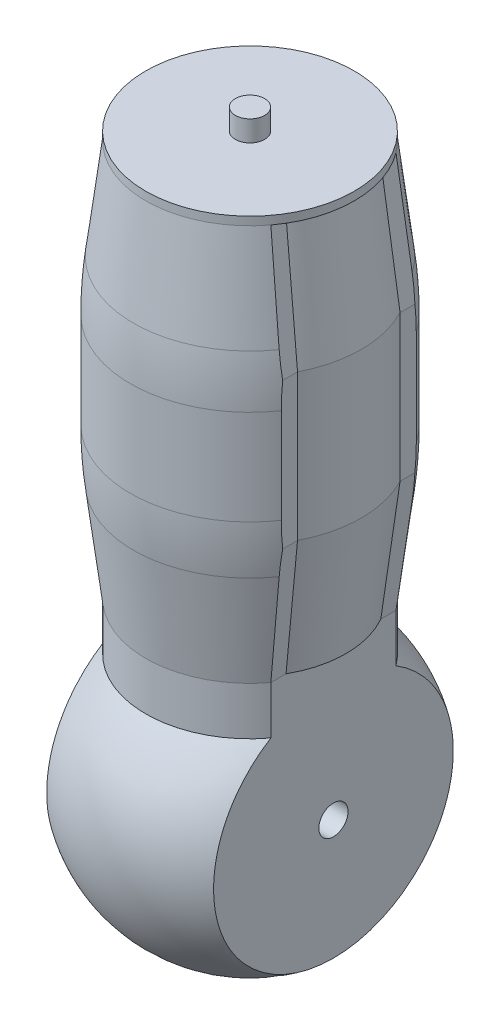
from build123d import *

# Parameters (mm, degrees)
CUT_EXTRUDE1_START  = -28.722813
SKETCH2_OUTSIDE_W   = 96.248
SKETCH2_OUTSIDE_H   = 96.248
CUT_EXTRUDE1_DEPTH  = 57.445626
BOSS_EXTRUDE1_DEPTH = 36
SKETCH4_R           = 3.5
CUT_EXTRUDE2_DEPTH  = 5
LPATTERN1_COUNT     = 2
LPATTERN1_PITCH     = 35
BOSS_EXTRUDE2_DEPTH = 30
BOSS_EXTRUDE2_DRAFT = -7
BOSS_EXTRUDE6_DEPTH = 35
BOSS_EXTRUDE9_DEPTH = 30
BOSS_EXTRUDE9_DRAFT = 7
SKETCH10_R          = 25
BOSS_EXTRUDE7_DEPTH = 2
SKETCH11_R          = 3.5
BOSS_EXTRUDE8_DEPTH = 5
FILLET3_R           = 100


with BuildPart() as part:
    # Sketch1 → Revolve2 (revolve)
    with BuildSketch(Plane(origin=(0, 0, 0), x_dir=(1, 0, 0), z_dir=(0, 1, 0))):
        with BuildLine():
            Line((0, 35), (0, -35))
            ThreePointArc((0, -35), (35, 0), (0, 35))
        make_face()
    revolve(axis=Axis((0, 0, -35), (0, 0, 1)))

    # Sketch2 outside → Cut-Extrude1 (cut)
    with BuildSketch(Plane(origin=(0, 0, 0), x_dir=(1, 0, 0), z_dir=(0, 1, 0)).offset(CUT_EXTRUDE1_START)):
        Rectangle(SKETCH2_OUTSIDE_W, SKETCH2_OUTSIDE_H)
        with BuildLine():
            Line((-20, -28.722813233), (-20, 28.722813233))
            ThreePointArc((-20, 28.722813233), (0, 35), (20, 28.722813233))
            Line((20, 28.722813233), (20, -28.722813233))
            ThreePointArc((20, -28.722813233), (0, -35), (-20, -28.722813233))
        make_face(mode=Mode.SUBTRACT)
    extrude(amount=CUT_EXTRUDE1_DEPTH, mode=Mode.SUBTRACT)

    # Sketch3 → Boss-Extrude1 (add)
    with BuildSketch(Plane(origin=(0, 0, 0), x_dir=(1, 0, 0), z_dir=(0, 1, 0))):
        with BuildLine():
            Line((-20, 15), (-20, -15))
            ThreePointArc((-20, -15), (0, -25), (20, -15))
            Line((20, -15), (20, 15))
            ThreePointArc((20, 15), (0, 25), (-20, 15))
        make_face()
    extrude(amount=BOSS_EXTRUDE1_DEPTH)

    # Sketch4 → Cut-Extrude2 (cut)
    with BuildSketch(Plane.ZY.offset(20)):
        Circle(SKETCH4_R)
    cut_extrude2 = extrude(amount=-CUT_EXTRUDE2_DEPTH, mode=Mode.SUBTRACT)

    # LPattern1: Cut-Extrude2 ×2
    with Locations(*[(i * LPATTERN1_PITCH, 0, 0) for i in range(1, LPATTERN1_COUNT)]):
        add(cut_extrude2, mode=Mode.SUBTRACT)


with BuildPart() as boss_extrude2_tool:
    # Sketch5 → Boss-Extrude2 (with draft: the straight prism first)
    with BuildSketch(Plane(origin=(0, 36, 0), x_dir=(1, 0, 0), z_dir=(0, 1, 0))):
        with BuildLine():
            Line((-20, 15), (-20, 11.357816692))
            ThreePointArc((-20, 11.357816692), (-23, 0), (-20, -11.357816692))
            Line((-20, -11.357816692), (-20, -15))
            ThreePointArc((-20, -15), (0, -25), (20, -15))
            Line((20, -15), (20, -11.357816692))
            ThreePointArc((20, -11.357816692), (23, 0), (20, 11.357816692))
            Line((20, 11.357816692), (20, 15))
            ThreePointArc((20, 15), (0, 25), (-20, 15))
        make_face()
    extrude(amount=BOSS_EXTRUDE2_DEPTH)
    # Boss-Extrude2: the draft: its side faces are tilted about the plane it starts from
    boss_extrude2_sides = [boss_extrude2_tool.faces().sort_by_distance(p)[0] for p in [
        (20, 51, -13.178908346),
        (0, 51, -25),
        (-20, 51, -13.178908346),
        (-23, 51, 0),
        (-20, 51, 13.178908346),
        (0, 51, 25),
        (20, 51, 13.178908346),
        (23, 51, 0),
    ]]
    draft(boss_extrude2_sides, Plane(origin=(0, 36, 0), x_dir=(1, 0, 0), z_dir=(0, 1, 0)), BOSS_EXTRUDE2_DRAFT)


with BuildPart() as part_1:
    add(part.part)

    # Boss-Extrude2: add boss_extrude2_tool
    add(boss_extrude2_tool.part)

    # Sketch9 → Boss-Extrude6 (add)
    with BuildSketch(Plane(origin=(0, 66, 0), x_dir=(1, 0, 0), z_dir=(0, 1, 0))):
        with BuildLine():
            Line((23.683536827, 12.29232366), (23.683536827, 16.181327766))
            ThreePointArc((23.683536827, 16.181327766), (0, 28.683536827), (-23.683536827, 16.181327766))
            Line((-23.683536827, 16.181327766), (-23.683536827, 12.29232366))
            ThreePointArc((-23.683536827, 12.29232366), (-26.683536827, 0), (-23.683536827, -12.29232366))
            Line((-23.683536827, -12.29232366), (-23.683536827, -16.181327766))
            ThreePointArc((-23.683536827, -16.181327766), (0, -28.683536827), (23.683536827, -16.181327766))
            Line((23.683536827, -16.181327766), (23.683536827, -12.29232366))
            ThreePointArc((23.683536827, -12.29232366), (26.683536827, 0), (23.683536827, 12.29232366))
        make_face()
    extrude(amount=BOSS_EXTRUDE6_DEPTH)


with BuildPart() as boss_extrude9_tool:
    # Sketch12 → Boss-Extrude9 (with draft: the straight prism first)
    with BuildSketch(Plane(origin=(0, 101, 0), x_dir=(1, 0, 0), z_dir=(0, 1, 0))):
        with BuildLine():
            Line((23.683536827, 12.29232366), (23.683536827, 16.181327766))
            ThreePointArc((23.683536827, 16.181327766), (0, 28.683536827), (-23.683536827, 16.181327766))
            Line((-23.683536827, 16.181327766), (-23.683536827, 12.29232366))
            ThreePointArc((-23.683536827, 12.29232366), (-26.683536827, 0), (-23.683536827, -12.29232366))
            Line((-23.683536827, -12.29232366), (-23.683536827, -16.181327766))
            ThreePointArc((-23.683536827, -16.181327766), (0, -28.683536827), (23.683536827, -16.181327766))
            Line((23.683536827, -16.181327766), (23.683536827, -12.29232366))
            ThreePointArc((23.683536827, -12.29232366), (26.683536827, 0), (23.683536827, 12.29232366))
        make_face()
    extrude(amount=BOSS_EXTRUDE9_DEPTH)
    # Boss-Extrude9: the draft: its side faces are tilted about the plane it starts from
    boss_extrude9_sides = [boss_extrude9_tool.faces().sort_by_distance(p)[0] for p in [
        (0, 116, 28.683536827),
        (23.683536827, 116, 14.236825713),
        (26.683536827, 116, 0),
        (23.683536827, 116, -14.236825713),
        (0, 116, -28.683536827),
        (-23.683536827, 116, -14.236825713),
        (-26.683536827, 116, 0),
        (-23.683536827, 116, 14.236825713),
    ]]
    draft(boss_extrude9_sides, Plane(origin=(0, 101, 0), x_dir=(1, 0, 0), z_dir=(0, 1, 0)), BOSS_EXTRUDE9_DRAFT)


with BuildPart() as part_2:
    add(part_1.part)

    # Boss-Extrude9: add boss_extrude9_tool
    add(boss_extrude9_tool.part)

    # Sketch10 → Boss-Extrude7 (add)
    with BuildSketch(Plane(origin=(0, 131, 0), x_dir=(1, 0, 0), z_dir=(0, 1, 0))):
        with Locations(Location((0, 0, 0), (0, 0, 36.869897646))):
            Circle(SKETCH10_R)
    extrude(amount=BOSS_EXTRUDE7_DEPTH)

    # Sketch11 → Boss-Extrude8 (add)
    with BuildSketch(Plane(origin=(0, 133, 0), x_dir=(1, 0, 0), z_dir=(0, 1, 0))):
        with Locations(Location((0, 0, 0), (0, 0, 270))):
            Circle(SKETCH11_R)
    extrude(amount=BOSS_EXTRUDE8_DEPTH)

    # Fillet3
    # the kernel refuses this fillet: 100 mm, written as the material it takes off along each edge
    with BuildSketch(Plane(origin=(0, 66, 0), x_dir=(0.9978245122586105, 0, -0.06592603989218485), z_dir=(0.06592603989218485, 0, 0.9978245122586105))) as fillet3_piece_1:
        with BuildLine():
            CenterArc((28.683536827 - FILLET3_R, FILLET3_R * 0.0611626201505), FILLET3_R, 353, 7)
            Line((28.683536827, FILLET3_R * 0.0611626201505), (28.683536827, 0))
            Line((28.683536827, 0), (28.683536827 - FILLET3_R * 0.00745384835868, -FILLET3_R * 0.0607067232547))
        make_face()
    revolve(axis=Axis((0, 66, 0), (0, 1, 0)), revolution_arc=172.439949247, mode=Mode.SUBTRACT)
    with BuildSketch(Plane(origin=(0, 101, 0), x_dir=(0.9978245122586106, 0, -0.06592603989218539), z_dir=(0.06592603989218539, 0, 0.9978245122586106))) as fillet3_piece_2:
        with BuildLine():
            CenterArc((28.683536827 - FILLET3_R, -FILLET3_R * 0.0611626201505), FILLET3_R, 0, 7)
            Line((28.683536827 - FILLET3_R * 0.00745384835868, FILLET3_R * 0.0607067232547), (28.683536827, 0))
            Line((28.683536827, 0), (28.683536827, -FILLET3_R * 0.0611626201505))
        make_face()
    revolve(axis=Axis((0, 101, 0), (0, 1, 0)), revolution_arc=172.439949247, mode=Mode.SUBTRACT)
    with BuildSketch(Plane(origin=(0, 101, 0), x_dir=(-0.9978245122586106, 0, 0.06592603989218528), z_dir=(-0.06592603989218528, 0, -0.9978245122586106))) as fillet3_piece_3:
        with BuildLine():
            CenterArc((28.683536827 - FILLET3_R, -FILLET3_R * 0.0611626201505), FILLET3_R, 0, 7)
            Line((28.683536827 - FILLET3_R * 0.00745384835868, FILLET3_R * 0.0607067232547), (28.683536827, 0))
            Line((28.683536827, 0), (28.683536827, -FILLET3_R * 0.0611626201505))
        make_face()
    revolve(axis=Axis((0, 101, 0), (0, 1, 0)), revolution_arc=172.439949247, mode=Mode.SUBTRACT)
    with BuildSketch(Plane(origin=(0, 66, 0), x_dir=(-0.9978245122586105, 0, 0.06592603989218485), z_dir=(-0.06592603989218485, 0, -0.9978245122586105))) as fillet3_piece_4:
        with BuildLine():
            CenterArc((28.683536827 - FILLET3_R, FILLET3_R * 0.0611626201505), FILLET3_R, 353, 7)
            Line((28.683536827, FILLET3_R * 0.0611626201505), (28.683536827, 0))
            Line((28.683536827, 0), (28.683536827 - FILLET3_R * 0.00745384835868, -FILLET3_R * 0.0607067232547))
        make_face()
    revolve(axis=Axis((0, 66, 0), (0, 1, 0)), revolution_arc=172.439949247, mode=Mode.SUBTRACT)


solid = part_2.part
